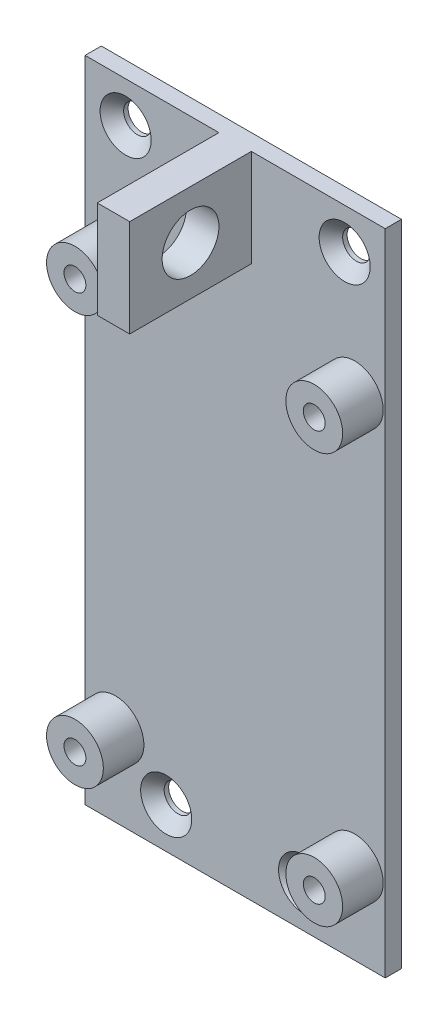
from build123d import *

# Parameters (mm, degrees)
MAIN_SKETCH_W                               = 37
MAIN_SKETCH_H                               = 80
MAIN_EXTRUSION_DEPTH                        = 2
BOARD_FIX_SKETCH_R                          = 3.5
BOARD_FIX_SKETCH_R_2                        = 1.35
BOARD_FIX_DEPTH                             = 5
FRAISAGE_POUR_VIS_T_TE_FRAIS_E_M31_AT_COUNT = 2
FRAISAGE_POUR_VIS_T_TE_FRAIS_E_M31_AT_PITCH = 17
FRAISAGE_POUR_VIS_T_TE_FRAIS_E_M31_2_COUNT  = 2
FRAISAGE_POUR_VIS_T_TE_FRAIS_E_M31_2_PITCH  = 73.375745311
FRAISAGE_POUR_VIS_T_TE_FRAIS_E_M31_3_COUNT  = 2
FRAISAGE_POUR_VIS_T_TE_FRAIS_E_M31_3_PITCH  = 70.178344238
JACK_FIX_SKETCH_W                           = 4
JACK_FIX_SKETCH_H                           = 12
JACK_FIX_DEPTH                              = 15
JACK_FIX_HOLE_SKETCH_R                      = 3.5
JACK_FIX_HOLE_DEPTH                         = 85.316368518


with BuildPart() as part:
    # Main-Sketch → Main-Extrusion (new body)
    with BuildSketch(Plane.XY):
        with Locations((18.5, 40)):
            Rectangle(MAIN_SKETCH_W, MAIN_SKETCH_H)
    extrude(amount=MAIN_EXTRUSION_DEPTH)

    # Board-Fix-Sketch → Board-Fix (add)
    # profile 1 of 4: a face of its own
    with BuildSketch(Plane.XY.offset(2)):
        with Locations((3.75, 10)):
            Circle(BOARD_FIX_SKETCH_R)
        with Locations((3.75, 10)):
            Circle(BOARD_FIX_SKETCH_R_2, mode=Mode.SUBTRACT)
    # profile 2 of 4: a face of its own
    with BuildSketch(Plane.XY.offset(2)):
        with Locations((33.25, 10)):
            Circle(BOARD_FIX_SKETCH_R)
        with Locations((33.25, 10)):
            Circle(BOARD_FIX_SKETCH_R_2, mode=Mode.SUBTRACT)
    # profile 3 of 4: a face of its own
    with BuildSketch(Plane.XY.offset(2)):
        with Locations((33.25, 60.5)):
            Circle(BOARD_FIX_SKETCH_R)
        with Locations((33.25, 60.5)):
            Circle(BOARD_FIX_SKETCH_R_2, mode=Mode.SUBTRACT)
    # profile 4 of 4: a face of its own
    with BuildSketch(Plane.XY.offset(2)):
        with Locations((3.75, 60.5)):
            Circle(BOARD_FIX_SKETCH_R)
        with Locations((3.75, 60.5)):
            Circle(BOARD_FIX_SKETCH_R_2, mode=Mode.SUBTRACT)
    extrude(amount=BOARD_FIX_DEPTH)

    # Esquisse4 → Fraisage pour vis à tête fraisée M31 (revolve, cut)
    with BuildSketch(Plane(origin=(10, 5, 2), x_dir=(0, -1, 0), z_dir=(1, 0, 0))):
        Polygon((0, 0), (0, 2), (1.7, 2), (1.7, 1.45), (3.15, 0), align=None)
    fraisage_pour_vis_t_te_frais_e_m31 = revolve(axis=Axis((10, 5, 8.35), (0, 0, -1)), mode=Mode.SUBTRACT)

    # Fraisage pour vis à tête fraisée M31 at: Fraisage pour vis à tête fraisée M31 ×2
    with Locations(*[(i * FRAISAGE_POUR_VIS_T_TE_FRAIS_E_M31_AT_PITCH, 0, 0) for i in range(1, FRAISAGE_POUR_VIS_T_TE_FRAIS_E_M31_AT_COUNT)]):
        add(fraisage_pour_vis_t_te_frais_e_m31, mode=Mode.SUBTRACT)

    # Fraisage pour vis _ t_te frais_e M31 2: Fraisage pour vis à tête fraisée M31 ×2
    with Locations(*[Vector(0.2998265967403946, 0.9539937169012556, 0) * (i * FRAISAGE_POUR_VIS_T_TE_FRAIS_E_M31_2_PITCH) for i in range(1, FRAISAGE_POUR_VIS_T_TE_FRAIS_E_M31_2_COUNT)]):
        add(fraisage_pour_vis_t_te_frais_e_m31, mode=Mode.SUBTRACT)

    # Fraisage pour vis _ t_te frais_e M31 3: Fraisage pour vis à tête fraisée M31 ×2
    with Locations(*[Vector(-0.07124704998790968, 0.997458699830735, 0) * (i * FRAISAGE_POUR_VIS_T_TE_FRAIS_E_M31_3_PITCH) for i in range(1, FRAISAGE_POUR_VIS_T_TE_FRAIS_E_M31_3_COUNT)]):
        add(fraisage_pour_vis_t_te_frais_e_m31, mode=Mode.SUBTRACT)

    # Jack-Fix-Sketch → Jack-Fix (add)
    with BuildSketch(Plane.XY.offset(2)):
        with Locations((18.5, 74)):
            Rectangle(JACK_FIX_SKETCH_W, JACK_FIX_SKETCH_H)
    extrude(amount=JACK_FIX_DEPTH)

    # Jack-Fix-Hole-Sketch → Jack-Fix-Hole (cut, through all)
    with BuildSketch(Plane(origin=(20.5, 0, 0), x_dir=(0, 0, -1), z_dir=(1, 0, 0))):
        with Locations((-9.5, 74)):
            Circle(JACK_FIX_HOLE_SKETCH_R)
    extrude(amount=-JACK_FIX_HOLE_DEPTH, mode=Mode.SUBTRACT)


solid = part.part
